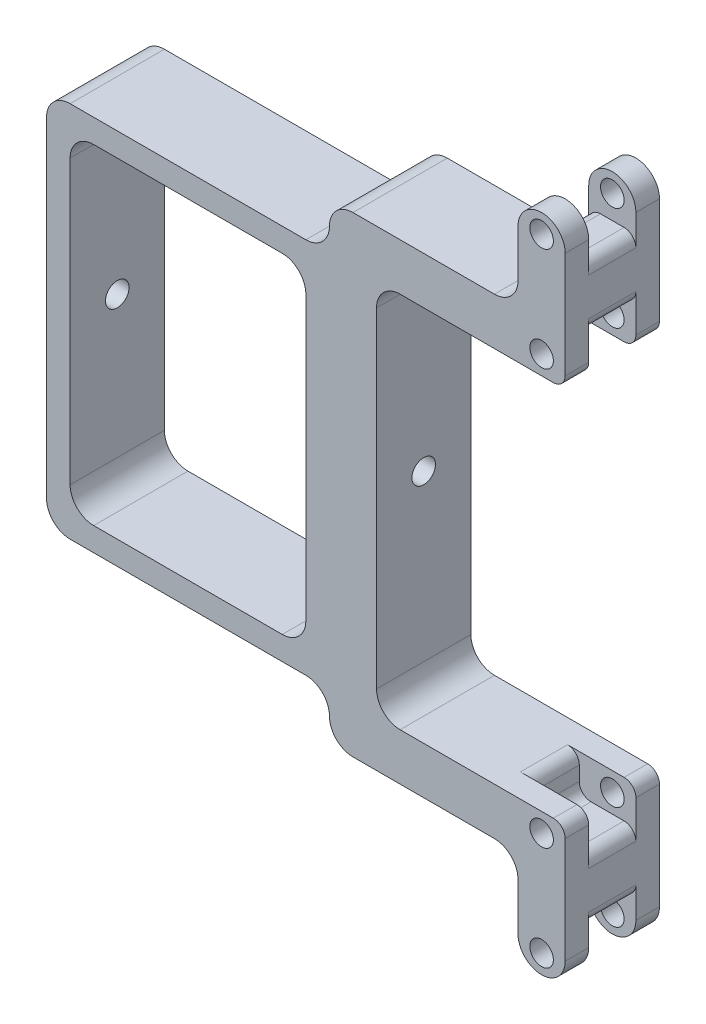
from build123d import *

# Parameters (mm, degrees)
SKETCH1_W           = 60
SKETCH1_H           = 80
SKETCH1_W_2         = 50
SKETCH1_H_2         = 70
EXTRUDE_THIN2_DEPTH = 20
EXTRUDE_THIN4_START = -20
EXTRUDE_THIN4_DEPTH = 20
SKETCH3_R           = 2.5
CUT_EXTRUDE1_DEPTH  = 115.891252931
SKETCH4_W           = 17.535354843
SKETCH4_H           = 20
CUT_EXTRUDE2_DEPTH  = 115.891252931
FILLET1_RADIUS      = 5
FILLET1_LENGTH      = 20
SKETCH5_W           = 12
SKETCH5_H           = 8
SKETCH5_W_2         = 13.595286796
SKETCH5_H_2         = 19.881342556
CUT_EXTRUDE3_DEPTH  = 5
FILLET2_RADIUS      = 5
FILLET2_LENGTH      = 20
SKETCH6_R           = 2.5
CUT_EXTRUDE4_DEPTH  = 102.004981635
FILLET3_R           = 5
FILLET4_R           = 2.5


# Read off the part's stored shape, not the designer's step: Extrude-Thin4
with BuildPart() as part:
    # Sketch1 → Extrude-Thin2 (new body)
    with BuildSketch(Plane.XY):
        Rectangle(SKETCH1_W, SKETCH1_H)
        Rectangle(SKETCH1_W_2, SKETCH1_H_2, mode=Mode.SUBTRACT)
    extrude(amount=EXTRUDE_THIN2_DEPTH)

    # Extrude-Thin4 outline → Extrude-Thin4 (add)
    with BuildSketch(Plane.XY.offset(20).offset(EXTRUDE_THIN4_START)):
        Polygon((70, 50), (30, 50), (30, -50), (70, -50), (70, -80), (80, -80), (80, -40), (40, -40), (40, 40), (80, 40), (80, 80), (70, 80), align=None)
    extrude(amount=EXTRUDE_THIN4_DEPTH)

    # Sketch3 → Cut-Extrude1 (cut, through all)
    with BuildSketch(Plane.XY.offset(20)):
        with Locations((75, -66.014329355)):
            Circle(SKETCH3_R)
        with Locations((75, -44.014329355)):
            Circle(SKETCH3_R)
    cut_extrude1 = extrude(amount=-CUT_EXTRUDE1_DEPTH, mode=Mode.SUBTRACT)

    # Sketch4 → Cut-Extrude2 (cut, through all)
    with BuildSketch(Plane.XY.offset(20)):
        with Locations((73.91933671, -80.014329355)):
            Rectangle(SKETCH4_W, SKETCH4_H)
    cut_extrude2 = extrude(amount=-CUT_EXTRUDE2_DEPTH, mode=Mode.SUBTRACT)

    # Fillet1: full round fillet: the end face becomes a half cylinder, R = half its width
    fillet1_face = Plane((75, -70.014329355, 10), x_dir=(0, 0, 1), z_dir=(0, -1, 0))  # on the end face: x along it, z out of the body
    fillet1_slab = fillet1_face.offset(-FILLET1_RADIUS / 2) * Box(FILLET1_LENGTH, 2 * FILLET1_RADIUS, FILLET1_RADIUS, mode=Mode.PRIVATE)  # the body's end, R deep
    fillet1_round = Plane((75, -65.014329355, 10), x_dir=(0, -1, 0), z_dir=(0, 0, 1)) * Cylinder(FILLET1_RADIUS, FILLET1_LENGTH, mode=Mode.PRIVATE)  # its axis R under the face
    add(fillet1_slab - fillet1_round, mode=Mode.SUBTRACT)

    # Sketch5 → Cut-Extrude3 (cut, symmetric)
    with BuildSketch(Plane.XY.offset(10)):
        with Locations((74, -44)):
            Rectangle(SKETCH5_W, SKETCH5_H)
        with Locations((75.604543017, -70.955000633)):
            Rectangle(SKETCH5_W_2, SKETCH5_H_2)
    cut_extrude3 = extrude(amount=CUT_EXTRUDE3_DEPTH, both=True, mode=Mode.SUBTRACT)

    # Mirror6: Cut-Extrude1 across plane
    add(cut_extrude1.mirror(Plane(origin=(0, 0, 0), x_dir=(0, 0, 1), z_dir=(0, -1, 0))), mode=Mode.SUBTRACT)

    # Mirror8: Cut-Extrude2 across plane
    add(cut_extrude2.mirror(Plane(origin=(0, 0, 0), x_dir=(0, 0, 1), z_dir=(0, -1, 0))), mode=Mode.SUBTRACT)

    # Fillet2: full round fillet: the end face becomes a half cylinder, R = half its width
    fillet2_face = Plane((75, 70.014329355, 10), x_dir=(0, 0, -1), z_dir=(0, 1, 0))  # on the end face: x along it, z out of the body
    fillet2_slab = fillet2_face.offset(-FILLET2_RADIUS / 2) * Box(FILLET2_LENGTH, 2 * FILLET2_RADIUS, FILLET2_RADIUS, mode=Mode.PRIVATE)  # the body's end, R deep
    fillet2_round = Plane((75, 65.014329355, 10), x_dir=(0, 1, 0), z_dir=(0, 0, -1)) * Cylinder(FILLET2_RADIUS, FILLET2_LENGTH, mode=Mode.PRIVATE)  # its axis R under the face
    add(fillet2_slab - fillet2_round, mode=Mode.SUBTRACT)

    # Mirror9: Cut-Extrude3 across plane
    add(cut_extrude3.mirror(Plane(origin=(0, 0, 0), x_dir=(0, 0, 1), z_dir=(0, -1, 0))), mode=Mode.SUBTRACT)

    # Sketch6 → Cut-Extrude4 (cut, through all)
    with BuildSketch(Plane(origin=(40, 0, 0), x_dir=(0, 0, -1), z_dir=(1, 0, 0))):
        with Locations((-10, 0)):
            Circle(SKETCH6_R)
    extrude(amount=-CUT_EXTRUDE4_DEPTH, mode=Mode.SUBTRACT)

    # Fillet3
    fillet3_edges = [part.edges().sort_by_distance(p)[0] for p in [
        (-30, -40, 10),
        (70, -50, 10),
        (70, 50, 10),
        (30, 50, 10),
        (30, -50, 10),
        (-25, -35, 10),
        (25, -35, 10),
        (25, 35, 10),
        (-25, 35, 10),
        (30, -40, 10),
        (30, 40, 10),
        (-30, 40, 10),
        (40, -40, 10),
        (40, 40, 10),
    ]]
    fillet(fillet3_edges, radius=FILLET3_R - 0.0001)  # a hair under: the kernel refuses the full size

    # Fillet4
    fillet4_edges = [part.edges().sort_by_distance(p)[0] for p in [
        (80, -40, 17.5),
        (80, -61.014329355, 10),
        (80, -48, 10),
        (68, -40, 10),
        (68, -48, 10),
        (70, -61.014329355, 10),
        (80, 40, 17.5),
        (80, 61.014329355, 10),
        (80, 48, 10),
        (68, 48, 10),
        (68, 40, 10),
        (70, 61.014329355, 10),
        (80, 40, 2.5),
        (80, -40, 2.5),
    ]]
    fillet(fillet4_edges, radius=FILLET4_R)


solid = part.part
